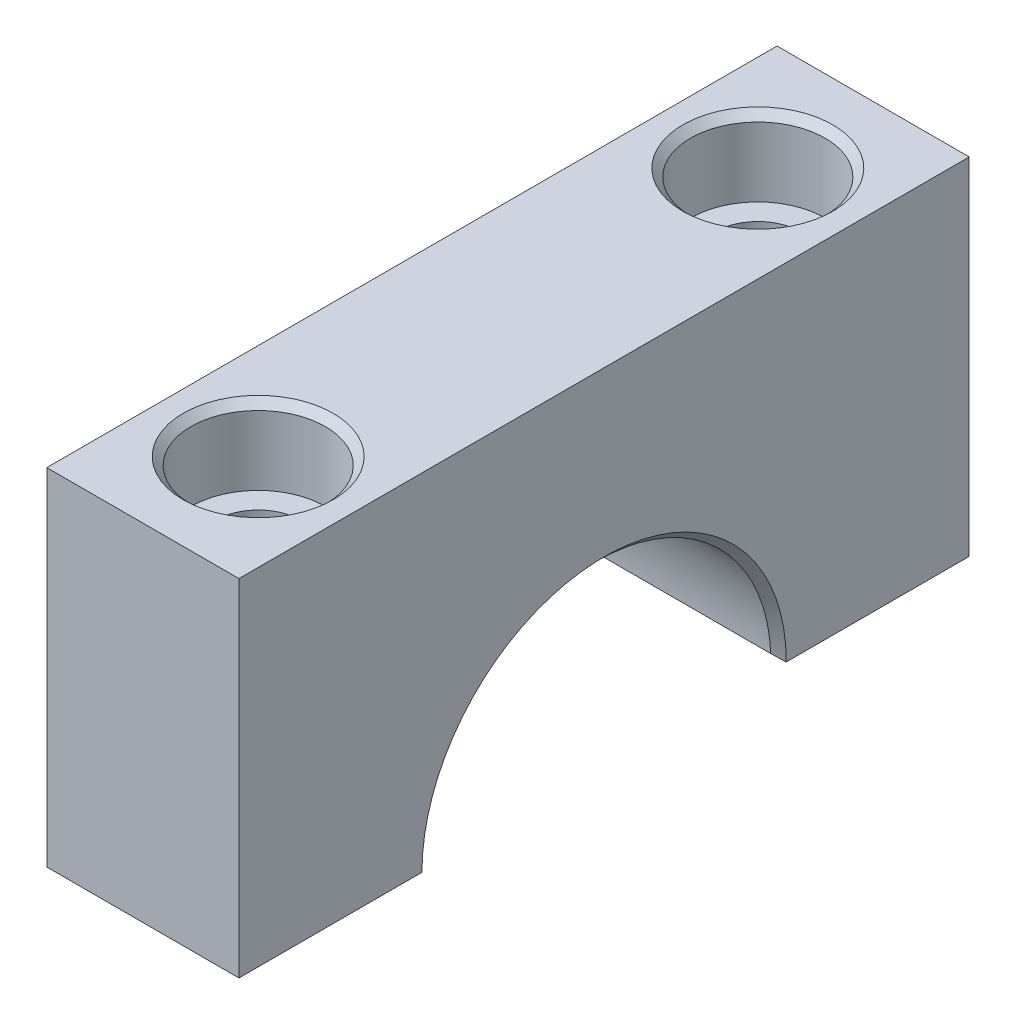
from build123d import *

# Parameters (mm, degrees)
BOSS_EXTRUDE1_DEPTH                           = 15.875
BOSS_EXTRUDE2_DEPTH                           = 15.875
CBORE_FOR_1_4_SOCKET_HEAD_CAP_SCREW1_AT_COUNT = 2
CBORE_FOR_1_4_SOCKET_HEAD_CAP_SCREW1_AT_PITCH = 41.275
MOVE_FACE1_BY                                 = 0.127
MOVE_FACE1_2_BY                               = 0.127
MOVE_START                                    = 28.575
MOVE_FACE2_OUTLINE_W                          = 15.875
MOVE_FACE2_OUTLINE_H                          = 60.325
MOVE_FACE2_OUTLINE_R                          = 5.55625
MOVE_FACE2_DEPTH                              = 6.35
MOVE_START_2                                  = 22.225
MOVE_FACE2_2_OUTLINE_R                        = 5.55625
MOVE_FACE2_2_OUTLINE_R_2                      = 3.57124
MOVE_FACE2_2_DEPTH                            = 6.35


with BuildPart() as part:
    # Sketch1 → Boss-Extrude1 (new body)
    with BuildSketch(Plane(origin=(0, 0, 0), x_dir=(0, 0, -1), z_dir=(1, 0, 0))):
        with BuildLine():
            Line((30.1625, 0), (14.2875, 0))
            ThreePointArc((14.2875, 0), (0, -14.2875), (-14.2875, 0))
            Line((-14.2875, 0), (-30.1625, 0))
            Line((-30.1625, 0), (-30.1625, -34.925))
            Line((-30.1625, -34.925), (30.1625, -34.925))
            Line((30.1625, -34.925), (30.1625, 0))
        make_face()
    extrude(amount=BOSS_EXTRUDE1_DEPTH)


with BuildPart() as body_2:
    # Sketch1<3> → Boss-Extrude2 (new body)
    with BuildSketch(Plane(origin=(0, 0, 0), x_dir=(0, 0, -1), z_dir=(1, 0, 0))):
        with BuildLine():
            ThreePointArc((-14.2875, 0), (0, 14.2875), (14.2875, 0))
            Line((14.2875, 0), (30.1625, 0))
            Line((30.1625, 0), (30.1625, 34.925))
            Line((30.1625, 34.925), (-30.1625, 34.925))
            Line((-30.1625, 34.925), (-30.1625, 0))
            Line((-30.1625, 0), (-14.2875, 0))
        make_face()
    extrude(amount=BOSS_EXTRUDE2_DEPTH)


with BuildPart() as cbore_for_1_4_socket_head_cap_screw1_tool:
    # Sketch4 → CBORE for 1/4 Socket Head Cap Screw1 (revolve)
    with BuildSketch(Plane(origin=(7.9375, 34.925, 20.6375), x_dir=(0, 0, 1), z_dir=(1, 0, 0))):
        Polygon((0, 0), (0, 69.85), (3.57124, 69.85), (3.57124, 6.35), (5.55625, 6.35), (5.55625, 0.635), (6.19125, 0), align=None)
    cbore_for_1_4_socket_head_cap_screw1 = revolve(axis=Axis((7.9375, 41.275, 20.6375), (0, -1, 0)))


with BuildPart() as part_1:
    add(part.part)

    # CBORE for 1/4 Socket Head Cap Screw1: cut by cbore_for_1_4_socket_head_cap_screw1_tool
    add(cbore_for_1_4_socket_head_cap_screw1_tool.part, mode=Mode.SUBTRACT)


with BuildPart() as body_2_1:
    add(body_2.part)

    # CBORE for 1/4 Socket Head Cap Screw1: cut by cbore_for_1_4_socket_head_cap_screw1_tool
    add(cbore_for_1_4_socket_head_cap_screw1_tool.part, mode=Mode.SUBTRACT)


with BuildPart() as cbore_for_1_4_socket_head_cap_screw1_at_tool:
    # CBORE for 1/4 Socket Head Cap Screw1 at: CBORE for 1/4 Socket Head Cap Screw1 ×2
    with Locations(*[(0, 0, -i * CBORE_FOR_1_4_SOCKET_HEAD_CAP_SCREW1_AT_PITCH) for i in range(1, CBORE_FOR_1_4_SOCKET_HEAD_CAP_SCREW1_AT_COUNT)]):
        add(cbore_for_1_4_socket_head_cap_screw1)


with BuildPart() as part_2:
    add(part_1.part)

    # CBORE for 1/4 Socket Head Cap Screw1 at: cut by cbore_for_1_4_socket_head_cap_screw1_at_tool
    add(cbore_for_1_4_socket_head_cap_screw1_at_tool.part, mode=Mode.SUBTRACT)

    # Move Face1 2: a curved face moved inward by 0.127
    add(Solid.thicken(part_2.faces().sort_by_distance((7.9375, -14.2875, 0))[0], -MOVE_FACE1_2_BY), mode=Mode.SUBTRACT)

    # Chamfer2
    # the kernel refuses this chamfer: 0.635 mm, written as the material it takes off along each edge
    with BuildSketch(Plane(origin=(0, 0, 0), x_dir=(0, 0.1132288377802066, -0.9935689358544497), z_dir=(0, 0.9935689358544497, 0.1132288377802066))) as chamfer2_piece_1:
        with BuildLine():
            Line((15.067460512, 0.017960512), (14.396539488, -0.652960512))
            Line((14.396539488, -0.652960512), (14.383839488, -0.652960512))
            ThreePointArc((14.383839488, -0.652960512), (14.4018, -0.326480256), (14.4018, 0))
            Line((14.4018, 0), (14.4145, 0.0127))
            ThreePointArc((14.4145, 0.0127), (14.740980256, 0.0127), (15.067460512, 0.030660512))
            Line((15.067460512, 0.030660512), (15.067460512, 0.017960512))
        make_face()
    revolve(axis=Axis((0, 0, 0), (-1, 0, 0)), revolution_arc=193.002955297, mode=Mode.SUBTRACT)
    with BuildSketch(Plane(origin=(-1.600435701, 0, -14.4145), x_dir=(0, 0, -1), z_dir=(1, 0, 0))) as chamfer2_piece_2:
        with BuildLine():
            Line((0.639932919, 0.017577515), (-0.031172593, -0.625784266))
            Line((-0.031172593, -0.625784266), (-0.043861283, -0.625248401))
            ThreePointArc((-0.043861283, -0.625248401), (-0.016099091, -0.31288099), (-0.0127, 0))
            Line((-0.0127, 0), (0, 0.0127))
            ThreePointArc((0, 0.0127), (0.319966459, 0.0127), (0.639932919, 0.030277515))
            Line((0.639932919, 0.030277515), (0.639932919, 0.017577515))
        make_face()
    extrude(amount=19.075871403, mode=Mode.SUBTRACT)
    with BuildSketch(Plane(origin=(-1.600435701, 0, 14.4145), x_dir=(0, -0.999777333387341, -0.021101745067597762), z_dir=(1, 0, 0))) as chamfer2_piece_3:
        with BuildLine():
            Line((0.626302721, 0.017960512), (-0.031077302, -0.639419511))
            Line((-0.031077302, -0.639419511), (-0.043774474, -0.639151519))
            ThreePointArc((-0.043774474, -0.639151519), (-0.019449023, -0.319627221), (-0.012697172, 0.000267992))
            Line((-0.012697172, 0.000267992), (0.000267992, 0.012697172))
            ThreePointArc((0.000267992, 0.012697172), (0.313151041, 0.009493172), (0.626034729, 0.030657684))
            Line((0.626034729, 0.030657684), (0.626302721, 0.017960512))
        make_face()
    extrude(amount=19.075871403, mode=Mode.SUBTRACT)
    with BuildSketch(Plane(origin=(15.875, 0, 0), x_dir=(0, 0.11322883778020662, -0.9935689358544497), z_dir=(0, 0.9935689358544497, 0.11322883778020662))) as chamfer2_piece_4:
        with BuildLine():
            Line((14.396539488, 0.652960512), (15.067460512, -0.017960512))
            Line((15.067460512, -0.017960512), (15.067460512, -0.030660512))
            ThreePointArc((15.067460512, -0.030660512), (14.740980256, -0.0127), (14.4145, -0.0127))
            Line((14.4145, -0.0127), (14.4018, 0))
            ThreePointArc((14.4018, 0), (14.4018, 0.326480256), (14.383839488, 0.652960512))
            Line((14.383839488, 0.652960512), (14.396539488, 0.652960512))
        make_face()
    revolve(axis=Axis((15.875, 0, 0), (-1, 0, 0)), revolution_arc=193.002955297, mode=Mode.SUBTRACT)


with BuildPart() as body_2_2:
    add(body_2_1.part)

    # CBORE for 1/4 Socket Head Cap Screw1 at: cut by cbore_for_1_4_socket_head_cap_screw1_at_tool
    add(cbore_for_1_4_socket_head_cap_screw1_at_tool.part, mode=Mode.SUBTRACT)

    # Move Face1: a curved face moved inward by 0.127
    add(Solid.thicken(body_2_2.faces().sort_by_distance((7.9375, 14.2875, 0))[0], -MOVE_FACE1_BY), mode=Mode.SUBTRACT)

    # Move Face2: read off the stored shape, not the designer's step
    # Move Face2 outline → Move Face2 (cut)
    with BuildSketch(Plane(origin=(0, 0, 0), x_dir=(1, 0, 0), z_dir=(0, 1, 0)).offset(MOVE_START)):
        with Locations((7.9375, 0)):
            Rectangle(MOVE_FACE2_OUTLINE_W, MOVE_FACE2_OUTLINE_H)
        with Locations((7.9375, -20.6375)):
            Circle(MOVE_FACE2_OUTLINE_R, mode=Mode.SUBTRACT)
        with Locations((7.9375, 20.6375)):
            Circle(MOVE_FACE2_OUTLINE_R, mode=Mode.SUBTRACT)
    extrude(amount=MOVE_FACE2_DEPTH, mode=Mode.SUBTRACT)

    # Move Face2 2 outline → Move Face2 2 (cut)
    # profile 1 of 2: a face of its own
    with BuildSketch(Plane(origin=(0, 0, 0), x_dir=(1, 0, 0), z_dir=(0, 1, 0)).offset(MOVE_START_2)):
        with Locations((7.9375, 20.6375)):
            Circle(MOVE_FACE2_2_OUTLINE_R)
        with Locations((7.9375, 20.6375)):
            Circle(MOVE_FACE2_2_OUTLINE_R_2, mode=Mode.SUBTRACT)
    # profile 2 of 2: a face of its own
    with BuildSketch(Plane(origin=(0, 0, 0), x_dir=(1, 0, 0), z_dir=(0, 1, 0)).offset(MOVE_START_2)):
        with Locations((7.9375, -20.6375)):
            Circle(MOVE_FACE2_2_OUTLINE_R)
        with Locations((7.9375, -20.6375)):
            Circle(MOVE_FACE2_2_OUTLINE_R_2, mode=Mode.SUBTRACT)
    extrude(amount=MOVE_FACE2_2_DEPTH, mode=Mode.SUBTRACT)

    # Move Face2 3: loft between two sections, ruled curve by curve
    move_face2_3_from = [
        Edge.make_three_point_arc((7.9375, 27.94, -15.08125), (13.49375, 27.94, -20.6375), (7.9375, 27.94, -26.19375)),
        Edge.make_three_point_arc((7.9375, 27.94, -26.19375), (2.38125, 27.94, -20.6375), (7.9375, 27.94, -15.08125)),
    ]
    move_face2_3_to = [
        Edge.make_three_point_arc((7.9375, 28.575, -14.44625), (14.12875, 28.575, -20.6375), (7.9375, 28.575, -26.82875)),
        Edge.make_three_point_arc((7.9375, 28.575, -26.82875), (1.74625, 28.575, -20.6375), (7.9375, 28.575, -14.44625)),
    ]
    move_face2_3 = Solid(Shell([*[Face.make_surface_from_curves(move_face2_3_from[k], move_face2_3_to[k]) for k in range(2)], Face(Wire(move_face2_3_from)), Face(Wire(move_face2_3_to))]))
    add(move_face2_3, mode=Mode.SUBTRACT)

    # Move Face2 4: loft between two sections, ruled curve by curve
    move_face2_4_from = [
        Edge.make_three_point_arc((7.9375, 27.94, 26.19375), (13.49375, 27.94, 20.6375), (7.9375, 27.94, 15.08125)),
        Edge.make_three_point_arc((7.9375, 27.94, 15.08125), (2.38125, 27.94, 20.6375), (7.9375, 27.94, 26.19375)),
    ]
    move_face2_4_to = [
        Edge.make_three_point_arc((7.9375, 28.575, 26.82875), (14.12875, 28.575, 20.6375), (7.9375, 28.575, 14.44625)),
        Edge.make_three_point_arc((7.9375, 28.575, 14.44625), (1.74625, 28.575, 20.6375), (7.9375, 28.575, 26.82875)),
    ]
    move_face2_4 = Solid(Shell([*[Face.make_surface_from_curves(move_face2_4_from[k], move_face2_4_to[k]) for k in range(2)], Face(Wire(move_face2_4_from)), Face(Wire(move_face2_4_to))]))
    add(move_face2_4, mode=Mode.SUBTRACT)

    # Chamfer1
    # the kernel refuses this chamfer: 0.635 mm, written as the material it takes off along each edge
    with BuildSketch(Plane(origin=(0, 0, 0), x_dir=(0, -0.11322883778020673, 0.9935689358544497), z_dir=(0, -0.9935689358544497, -0.11322883778020673))) as chamfer1_piece_1:
        with BuildLine():
            Line((15.067460512, 0.017960512), (14.396539488, -0.652960512))
            Line((14.396539488, -0.652960512), (14.383839488, -0.652960512))
            ThreePointArc((14.383839488, -0.652960512), (14.4018, -0.326480256), (14.4018, 0))
            Line((14.4018, 0), (14.4145, 0.0127))
            ThreePointArc((14.4145, 0.0127), (14.740980256, 0.0127), (15.067460512, 0.030660512))
            Line((15.067460512, 0.030660512), (15.067460512, 0.017960512))
        make_face()
    revolve(axis=Axis((0, 0, 0), (-1, 0, 0)), revolution_arc=193.002955297, mode=Mode.SUBTRACT)
    with BuildSketch(Plane(origin=(-1.600435701, 0, 14.4145), x_dir=(0, 0, 1), z_dir=(1, 0, 0))) as chamfer1_piece_2:
        with BuildLine():
            Line((0.639932919, 0.017577515), (-0.031172593, -0.625784266))
            Line((-0.031172593, -0.625784266), (-0.043861283, -0.625248401))
            ThreePointArc((-0.043861283, -0.625248401), (-0.016099091, -0.31288099), (-0.0127, 0))
            Line((-0.0127, 0), (0, 0.0127))
            ThreePointArc((0, 0.0127), (0.319966459, 0.0127), (0.639932919, 0.030277515))
            Line((0.639932919, 0.030277515), (0.639932919, 0.017577515))
        make_face()
    extrude(amount=19.075871403, mode=Mode.SUBTRACT)
    with BuildSketch(Plane(origin=(-1.600435701, 0, -14.4145), x_dir=(0, 0.999777333387341, 0.021101745067597762), z_dir=(1, 0, 0))) as chamfer1_piece_3:
        with BuildLine():
            Line((0.626302721, 0.017960512), (-0.031077302, -0.639419511))
            Line((-0.031077302, -0.639419511), (-0.043774474, -0.639151519))
            ThreePointArc((-0.043774474, -0.639151519), (-0.019449023, -0.319627221), (-0.012697172, 0.000267992))
            Line((-0.012697172, 0.000267992), (0.000267992, 0.012697172))
            ThreePointArc((0.000267992, 0.012697172), (0.313151041, 0.009493172), (0.626034729, 0.030657684))
            Line((0.626034729, 0.030657684), (0.626302721, 0.017960512))
        make_face()
    extrude(amount=19.075871403, mode=Mode.SUBTRACT)
    with BuildSketch(Plane(origin=(15.875, 0, 0), x_dir=(0, -0.11322883778020675, 0.9935689358544497), z_dir=(0, -0.9935689358544497, -0.11322883778020675))) as chamfer1_piece_4:
        with BuildLine():
            Line((14.396539488, 0.652960512), (15.067460512, -0.017960512))
            Line((15.067460512, -0.017960512), (15.067460512, -0.030660512))
            ThreePointArc((15.067460512, -0.030660512), (14.740980256, -0.0127), (14.4145, -0.0127))
            Line((14.4145, -0.0127), (14.4018, 0))
            ThreePointArc((14.4018, 0), (14.4018, 0.326480256), (14.383839488, 0.652960512))
            Line((14.383839488, 0.652960512), (14.396539488, 0.652960512))
        make_face()
    revolve(axis=Axis((15.875, 0, 0), (-1, 0, 0)), revolution_arc=193.002955297, mode=Mode.SUBTRACT)


solid = body_2_2.part
